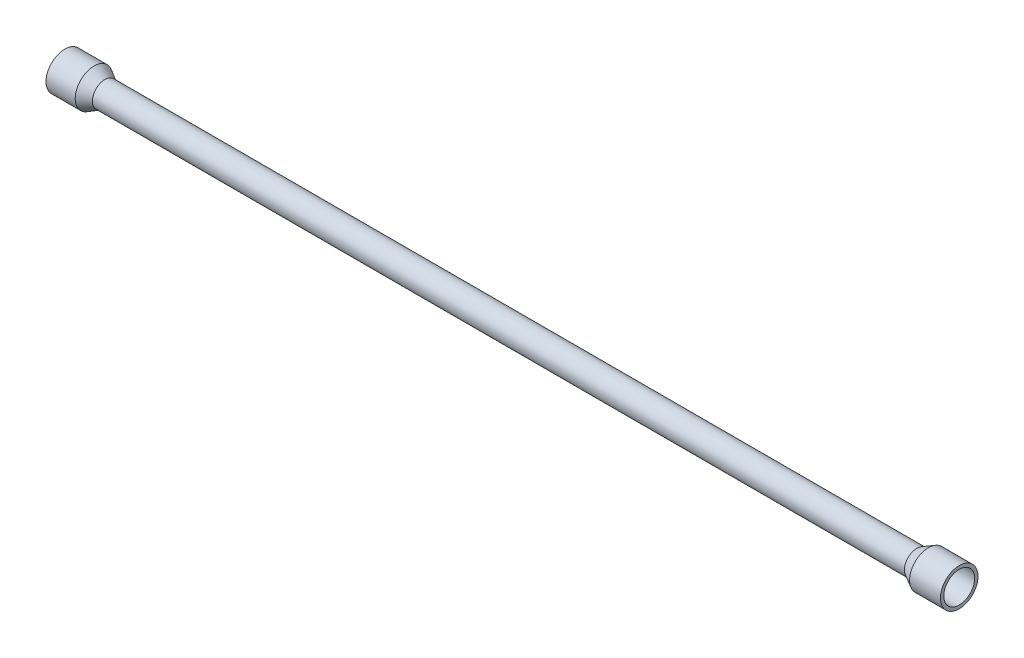
from build123d import *

# Parameters (mm, degrees)
SKETCH1_R           = 75
SKETCH1_R_2         = 37.5
BOSS_EXTRUDE1_DEPTH = 5000
SKETCH2_R           = 112.5
SKETCH2_R_2         = 92.5
BOSS_EXTRUDE2_DEPTH = 185
SKETCH6_R           = 112.5
SKETCH6_R_2         = 87.5
BOSS_EXTRUDE3_DEPTH = 175


with BuildPart() as part:
    # Sketch1 → Boss-Extrude1 (new body)
    with BuildSketch(Plane(origin=(0, 0, 0), x_dir=(0, 0, -1), z_dir=(1, 0, 0))):
        Circle(SKETCH1_R)
        Circle(SKETCH1_R_2, mode=Mode.SUBTRACT)
    extrude(amount=BOSS_EXTRUDE1_DEPTH)



with BuildPart() as body_2:
    # Sketch2 → Boss-Extrude2 (new body)
    with BuildSketch(Plane(origin=(5000, 0, 0), x_dir=(0, 0, -1), z_dir=(1, 0, 0))):
        Circle(SKETCH2_R)
        Circle(SKETCH2_R_2, mode=Mode.SUBTRACT)
    extrude(amount=BOSS_EXTRUDE2_DEPTH)


with BuildPart() as part_1:
    add(part.part)

    add(body_2.part)  # Revolve1 merges body 2
    # Sketch4 → Revolve1 (revolve)
    with BuildSketch(Plane.XY):
        Polygon((5000, 112.5), (4931.270461797, 75), (5000, 75), align=None)
    revolve(axis=Axis((5128.632077333, 0, 0), (-1, 0, 0)))



with BuildPart() as body_2_2:
    # Sketch6 → Boss-Extrude3 (new body)
    with BuildSketch(Plane.ZY):
        Circle(SKETCH6_R)
        Circle(SKETCH6_R_2, mode=Mode.SUBTRACT)
    extrude(amount=BOSS_EXTRUDE3_DEPTH)


with BuildPart() as part_2:
    add(part_1.part)

    add(body_2_2.part)  # Revolve2 merges body 2 2
    # Sketch7 → Revolve2 (revolve)
    with BuildSketch(Plane.XY):
        Polygon((0, 112.5), (65.363242372, 75), (0, 75), align=None)
    revolve(axis=Axis((0, 0, 0), (-1, 0, 0)))


solid = part_2.part
